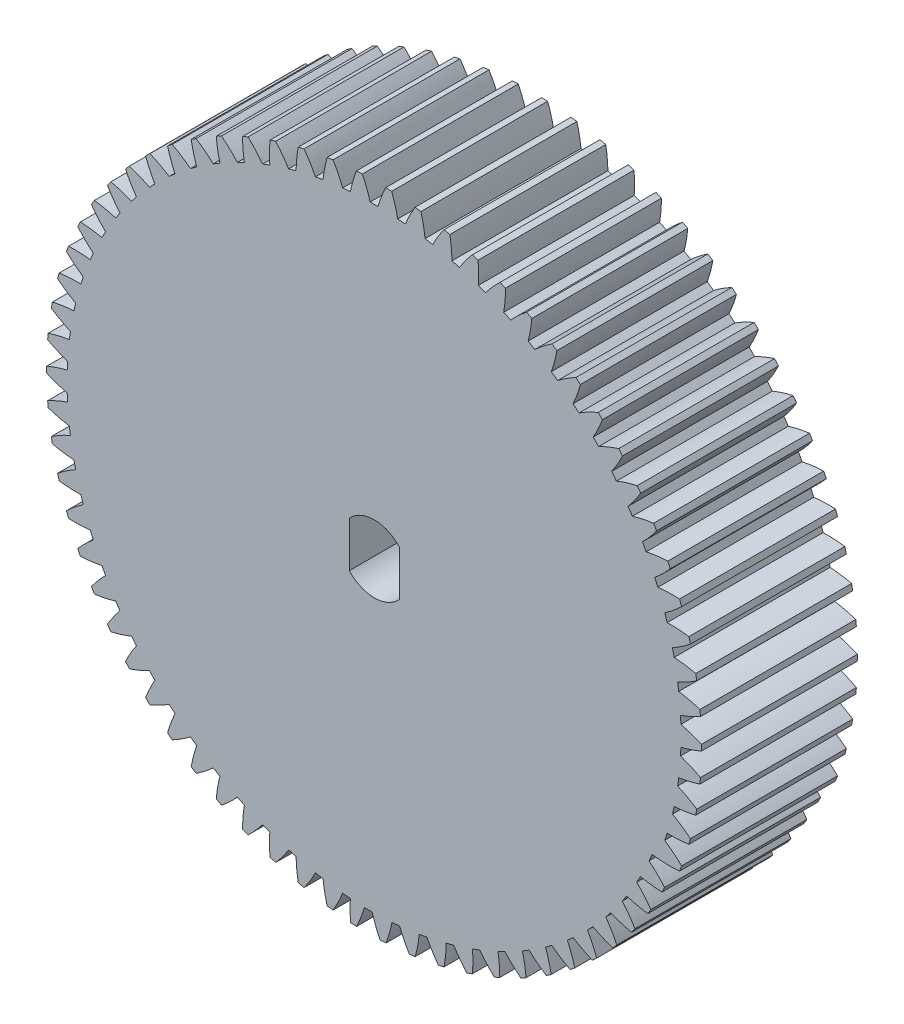
from build123d import *

# Parameters (mm, degrees)
SALIENTE_EXTRUIR1_DEPTH = 12


with BuildPart() as part:
    # Croquis1 → Saliente-Extruir1 (new body)
    with BuildSketch(Plane.XY):
        with BuildLine():
            ThreePointArc((-25.273967769, -0.161927654), (-24.491752842, -0.462970067), (-23.686675584, -0.696073767))
            ThreePointArc((-23.686675584, -0.696073767), (-23.675198138, -0.993730913), (-23.6599719, -1.291219853))
            ThreePointArc((-23.6599719, -1.291219853), (-24.44090051, -1.595548633), (-25.192969635, -1.96549124))
            ThreePointArc((-25.192969635, -1.96549124), (-25.173552209, -2.192751899), (-25.152078631, -2.419827502))
            ThreePointArc((-25.152078631, -2.419827502), (-24.346039764, -2.649537851), (-23.523320995, -2.809535754))
            ThreePointArc((-23.523320995, -2.809535754), (-23.485197172, -3.104967987), (-23.443351262, -3.399896028))
            ThreePointArc((-23.443351262, -3.399896028), (-24.193856263, -3.77300157), (-24.909736379, -4.208869854))
            ThreePointArc((-24.909736379, -4.208869854), (-24.870025633, -4.433475064), (-24.828283602, -4.65771165))
            ThreePointArc((-24.828283602, -4.65771165), (-24.004898532, -4.814244486), (-23.171149686, -4.899850343))
            ThreePointArc((-23.171149686, -4.899850343), (-23.106696997, -5.190675859), (-23.038582401, -5.480665568))
            ThreePointArc((-23.038582401, -5.480665568), (-23.752621166, -5.919543847), (-24.426548427, -6.417828452))
            ThreePointArc((-24.426548427, -6.417828452), (-24.36686409, -6.637969823), (-24.305189687, -6.857561972))
            ThreePointArc((-24.305189687, -6.857561972), (-23.471087829, -6.939656985), (-22.633021761, -6.950181547))
            ThreePointArc((-22.633021761, -6.950181547), (-22.542759141, -7.23405879), (-22.448924277, -7.516775341))
            ThreePointArc((-22.448924277, -7.516775341), (-23.120747786, -8.017892766), (-23.747296127, -8.574581797))
            ThreePointArc((-23.747296127, -8.574581797), (-23.66811874, -8.788486882), (-23.587008532, -9.001666566))
            ThreePointArc((-23.587008532, -9.001666566), (-22.748905583, -9.008662774), (-21.913269908, -8.944021305))
            ThreePointArc((-21.913269908, -8.944021305), (-21.797924099, -9.218664663), (-21.67912447, -9.491831787))
            ThreePointArc((-21.67912447, -9.491831787), (-22.303323596, -10.051153656), (-22.877448417, -10.661764982))
            ThreePointArc((-22.877448417, -10.661764982), (-22.779415471, -10.867711541), (-22.679522509, -11.072762363))
            ThreePointArc((-22.679522509, -11.072762363), (-21.844166381, -11.004603438), (-21.017689146, -10.865316391))
            ThreePointArc((-21.017689146, -10.865316391), (-20.878188845, -11.128514597), (-20.735380956, -11.389932915))
            ThreePointArc((-20.735380956, -11.389932915), (-21.306930014, -12.002955896), (-21.8240088, -12.662573232))
            ThreePointArc((-21.8240088, -12.662573232), (-21.707909599, -12.858903106), (-21.590038163, -13.054174118))
            ThreePointArc((-21.590038163, -13.054174118), (-20.764154651, -12.911408834), (-19.953490165, -12.698597668))
            ThreePointArc((-19.953490165, -12.698597668), (-19.790958546, -12.948231605), (-19.625292203, -13.195796329))
            ThreePointArc((-19.625292203, -13.195796329), (-20.139589416, -13.857584722), (-20.595458952, -14.560897218))
            ThreePointArc((-20.595458952, -14.560897218), (-20.462228258, -14.746029673), (-20.327327379, -14.929948667))
            ThreePointArc((-20.327327379, -14.929948667), (-19.517566013, -14.713726487), (-18.72924127, -14.429104632))
            ThreePointArc((-18.72924127, -14.429104632), (-18.544986942, -14.663164394), (-18.357795992, -14.894882279))
            ThreePointArc((-18.357795992, -14.894882279), (-18.810700541, -15.600107753), (-19.201690435, -16.34145275))
            ThreePointArc((-19.201690435, -16.34145275), (-19.052400943, -16.513897209), (-18.901556764, -16.684983378))
            ThreePointArc((-18.901556764, -16.684983378), (-18.114437266, -16.397045195), (-17.354799393, -16.042904259))
            ThreePointArc((-17.354799393, -16.042904259), (-17.150305863, -16.259505335), (-16.943097458, -16.473510724))
            ThreePointArc((-16.943097458, -16.473510724), (-17.330962822, -17.216495219), (-17.653925053, -17.989903842))
            ThreePointArc((-17.653925053, -17.989903842), (-17.489778754, -18.148271883), (-17.324205784, -18.305147742))
            ThreePointArc((-17.324205784, -18.305147742), (-16.566065577, -17.947811866), (-15.841230731, -17.527003183))
            ThreePointArc((-15.841230731, -17.527003183), (-15.618144462, -17.724401628), (-15.392586921, -17.918971476))
            ThreePointArc((-15.392586921, -17.918971476), (-15.712290237, -18.693732917), (-15.964624502, -19.492978136))
            ThreePointArc((-15.964624502, -19.492978136), (-15.786943007, -19.635994673), (-15.607974341, -19.777397149))
            ThreePointArc((-15.607974341, -19.777397149), (-14.884917524, -19.353540638), (-14.20072165, -18.869452313))
            ThreePointArc((-14.20072165, -18.869452313), (-13.9608388, -19.04605879), (-13.718748182, -19.219626535))
            ThreePointArc((-13.718748182, -19.219626535), (-13.967715386, -20.019926999), (-14.147390038, -20.838573761))
            ThreePointArc((-14.147390038, -20.838573761), (-13.957603933, -20.965087309), (-13.766680521, -21.089877912))
            ThreePointArc((-13.766680521, -21.089877912), (-13.084528724, -20.60291341), (-12.446480564, -20.059443036))
            ThreePointArc((-12.446480564, -20.059443036), (-12.191732529, -20.213835615), (-11.935058004, -20.365003792))
            ThreePointArc((-11.935058004, -20.365003792), (-12.111284559, -21.184399729), (-12.216852964, -22.015856771))
            ThreePointArc((-12.216852964, -22.015856771), (-12.016490294, -22.124848718), (-11.815149341, -22.232022708))
            ThreePointArc((-11.815149341, -22.232022708), (-11.179394848, -21.685870966), (-10.592631591, -21.087394248))
            ThreePointArc((-10.592631591, -21.087394248), (-10.325069453, -21.21832985), (-10.055877613, -21.345881341))
            ThreePointArc((-10.055877613, -21.345881341), (-10.157944645, -22.177775458), (-10.188556829, -23.015348377))
            ThreePointArc((-10.188556829, -23.015348377), (-9.979230798, -23.105941183), (-9.769093382, -23.194635659))
            ThreePointArc((-9.769093382, -23.194635659), (-9.184854914, -22.59369397), (-8.654100833, -21.945029491))
            ThreePointArc((-8.654100833, -21.945029491), (-8.375878844, -22.051453899), (-8.096337063, -22.154361734))
            ThreePointArc((-8.096337063, -22.154361734), (-8.123422791, -22.992056109), (-8.078832281, -23.829001261))
            ThreePointArc((-8.078832281, -23.829001261), (-7.862228258, -23.900465526), (-7.644986282, -23.969966371))
            ThreePointArc((-7.644986282, -23.969966371), (-7.116967784, -23.319073164), (-6.646496199, -22.625443588))
            ThreePointArc((-6.646496199, -22.625443588), (-6.35985444, -22.706499936), (-6.072213425, -22.783935563))
            ThreePointArc((-6.072213425, -22.783935563), (-6.024099768, -23.620685572), (-5.904665581, -24.450264366))
            ThreePointArc((-5.904665581, -24.450264366), (-5.682527536, -24.502024702), (-5.459930104, -24.551772336))
            ThreePointArc((-5.459930104, -24.551772336), (-4.992382871, -23.856168221), (-4.585981742, -23.123158246))
            ThreePointArc((-4.585981742, -23.123158246), (-4.293228083, -23.178193916), (-3.99980375, -23.229533868))
            ThreePointArc((-3.99980375, -23.229533868), (-3.876878092, -24.058602492), (-3.683561842, -24.874135648))
            ThreePointArc((-3.683561842, -24.874135648), (-3.457678299, -24.905775311), (-3.231517635, -24.935369197))
            ThreePointArc((-3.231517635, -24.935369197), (-2.828206082, -24.200654768), (-2.489147512, -23.434166159))
            ThreePointArc((-2.489147512, -23.434166159), (-2.192639034, -23.462738036), (-1.895793863, -23.487568954))
            ThreePointArc((-1.895793863, -23.487568954), (-1.918503057, -24.292813327), (-1.875, -25.097202345))
            ThreePointArc((-1.875, -25.097202345), (-1.647189639, -25.108466592), (-1.419286657, -25.117668455))
            ThreePointArc((-1.419286657, -25.117668455), (-1.083458011, -24.349759202), (-0.8144719, -23.555963275))
            ThreePointArc((-0.8144719, -23.555963275), (-0.516595915, -23.557841315), (-0.218719929, -23.555963275))
            ThreePointArc((-0.218719929, -23.555963275), (0.050266182, -24.349759202), (0.386094828, -25.117668455))
            ThreePointArc((0.386094828, -25.117668455), (0.61399781, -25.108466592), (0.841808171, -25.097202345))
            ThreePointArc((0.841808171, -25.097202345), (1.107450015, -24.302281021), (1.304197948, -23.487568954))
            ThreePointArc((1.304197948, -23.487568954), (1.601043119, -23.462738036), (1.897551597, -23.434166159))
            ThreePointArc((1.897551597, -23.434166159), (2.236610167, -24.200654768), (2.639921721, -24.935369197))
            ThreePointArc((2.639921721, -24.935369197), (2.866082384, -24.905775311), (3.091965928, -24.874135648))
            ThreePointArc((3.091965928, -24.874135648), (3.285282178, -24.058602492), (3.408207835, -23.229533868))
            ThreePointArc((3.408207835, -23.229533868), (3.701632168, -23.178193916), (3.994385827, -23.123158246))
            ThreePointArc((3.994385827, -23.123158246), (4.400786956, -23.856168221), (4.86833419, -24.551772336))
            ThreePointArc((4.86833419, -24.551772336), (5.090931621, -24.502024702), (5.313069667, -24.450264366))
            ThreePointArc((5.313069667, -24.450264366), (5.432503854, -23.620685572), (5.48061751, -22.783935563))
            ThreePointArc((5.48061751, -22.783935563), (5.768258525, -22.706499936), (6.054900284, -22.625443588))
            ThreePointArc((6.054900284, -22.625443588), (6.52537187, -23.319073164), (7.053390368, -23.969966371))
            ThreePointArc((7.053390368, -23.969966371), (7.270632344, -23.900465526), (7.487236366, -23.829001261))
            ThreePointArc((7.487236366, -23.829001261), (7.531826876, -22.992056109), (7.504741149, -22.154361734))
            ThreePointArc((7.504741149, -22.154361734), (7.78428293, -22.051453899), (8.062504918, -21.945029491))
            ThreePointArc((8.062504918, -21.945029491), (8.593258999, -22.59369397), (9.177497467, -23.194635659))
            ThreePointArc((9.177497467, -23.194635659), (9.387634883, -23.105941183), (9.596960914, -23.015348377))
            ThreePointArc((9.596960914, -23.015348377), (9.566348731, -22.177775458), (9.464281698, -21.345881341))
            ThreePointArc((9.464281698, -21.345881341), (9.733473538, -21.21832985), (10.001035677, -21.087394248))
            ThreePointArc((10.001035677, -21.087394248), (10.587798933, -21.685870966), (11.223553427, -22.232022708))
            ThreePointArc((11.223553427, -22.232022708), (11.42489438, -22.124848718), (11.625257049, -22.015856771))
            ThreePointArc((11.625257049, -22.015856771), (11.519688644, -21.184399729), (11.343462089, -20.365003792))
            ThreePointArc((11.343462089, -20.365003792), (11.600136615, -20.213835615), (11.85488465, -20.059443036))
            ThreePointArc((11.85488465, -20.059443036), (12.49293281, -20.60291341), (13.175084607, -21.089877912))
            ThreePointArc((13.175084607, -21.089877912), (13.366008018, -20.965087309), (13.555794123, -20.838573761))
            ThreePointArc((13.555794123, -20.838573761), (13.376119471, -20.019926999), (13.127152267, -19.219626535))
            ThreePointArc((13.127152267, -19.219626535), (13.369242886, -19.04605879), (13.609125736, -18.869452313))
            ThreePointArc((13.609125736, -18.869452313), (14.29332161, -19.353540638), (15.016378426, -19.777397149))
            ThreePointArc((15.016378426, -19.777397149), (15.195347092, -19.635994673), (15.373028588, -19.492978136))
            ThreePointArc((15.373028588, -19.492978136), (15.120694323, -18.693732917), (14.800991007, -17.918971476))
            ThreePointArc((14.800991007, -17.918971476), (15.026548547, -17.724401628), (15.249634817, -17.527003183))
            ThreePointArc((15.249634817, -17.527003183), (15.974469662, -17.947811866), (16.732609869, -18.305147742))
            ThreePointArc((16.732609869, -18.305147742), (16.89818284, -18.148271883), (17.062329138, -17.989903842))
            ThreePointArc((17.062329138, -17.989903842), (16.739366908, -17.216495219), (16.351501543, -16.473510724))
            ThreePointArc((16.351501543, -16.473510724), (16.558709948, -16.259505335), (16.763203478, -16.042904259))
            ThreePointArc((16.763203478, -16.042904259), (17.522841352, -16.397045195), (18.30996085, -16.684983378))
            ThreePointArc((18.30996085, -16.684983378), (18.460805029, -16.513897209), (18.61009452, -16.34145275))
            ThreePointArc((18.61009452, -16.34145275), (18.219104626, -15.600107753), (17.766200077, -14.894882279))
            ThreePointArc((17.766200077, -14.894882279), (17.953391027, -14.663164394), (18.137645356, -14.429104632))
            ThreePointArc((18.137645356, -14.429104632), (18.925970099, -14.713726487), (19.735731465, -14.929948667))
            ThreePointArc((19.735731465, -14.929948667), (19.870632344, -14.746029673), (20.003863038, -14.560897218))
            ThreePointArc((20.003863038, -14.560897218), (19.547993501, -13.857584722), (19.033696288, -13.195796329))
            ThreePointArc((19.033696288, -13.195796329), (19.199362631, -12.948231605), (19.361894251, -12.698597668))
            ThreePointArc((19.361894251, -12.698597668), (20.172558737, -12.911408834), (20.998442248, -13.054174118))
            ThreePointArc((20.998442248, -13.054174118), (21.116313684, -12.858903106), (21.232412885, -12.662573232))
            ThreePointArc((21.232412885, -12.662573232), (20.715334099, -12.002955896), (20.143785042, -11.389932915))
            ThreePointArc((20.143785042, -11.389932915), (20.28659293, -11.128514597), (20.426093231, -10.865316391))
            ThreePointArc((20.426093231, -10.865316391), (21.252570466, -11.004603438), (22.087926595, -11.072762363))
            ThreePointArc((22.087926595, -11.072762363), (22.187819557, -10.867711541), (22.285852502, -10.661764982))
            ThreePointArc((22.285852502, -10.661764982), (21.711727681, -10.051153656), (21.087528556, -9.491831787))
            ThreePointArc((21.087528556, -9.491831787), (21.206328184, -9.218664663), (21.321673993, -8.944021305))
            ThreePointArc((21.321673993, -8.944021305), (22.37778078, -9.030106977), (23.437008532, -9.001666566))
            ThreePointArc((23.437008532, -9.001666566), (23.51811874, -8.788486882), (23.597296127, -8.574581797))
            ThreePointArc((23.597296127, -8.574581797), (22.970747786, -8.017892766), (22.298924277, -7.516775341))
            ThreePointArc((22.298924277, -7.516775341), (22.392759141, -7.23405879), (22.483021761, -6.950181547))
            ThreePointArc((22.483021761, -6.950181547), (23.321087829, -6.939656985), (24.155189687, -6.857561972))
            ThreePointArc((24.155189687, -6.857561972), (24.21686409, -6.637969823), (24.276548427, -6.417828452))
            ThreePointArc((24.276548427, -6.417828452), (23.602621166, -5.919543847), (22.888582401, -5.480665568))
            ThreePointArc((22.888582401, -5.480665568), (22.956696997, -5.190675859), (23.021149686, -4.899850343))
            ThreePointArc((23.021149686, -4.899850343), (23.854898532, -4.814244486), (24.678283602, -4.65771165))
            ThreePointArc((24.678283602, -4.65771165), (24.720025633, -4.433475064), (24.759736379, -4.208869854))
            ThreePointArc((24.759736379, -4.208869854), (24.043856263, -3.77300157), (23.293351262, -3.399896028))
            ThreePointArc((23.293351262, -3.399896028), (23.335197172, -3.104967987), (23.373320995, -2.809535754))
            ThreePointArc((23.373320995, -2.809535754), (24.196039764, -2.649537851), (25.002078631, -2.419827502))
            ThreePointArc((25.002078631, -2.419827502), (25.023552209, -2.192751899), (25.042969635, -1.96549124))
            ThreePointArc((25.042969635, -1.96549124), (24.29090051, -1.595548633), (23.5099719, -1.291219853))
            ThreePointArc((23.5099719, -1.291219853), (23.525212204, -0.993728067), (23.536700211, -0.696067765))
            ThreePointArc((23.536700211, -0.696067765), (24.341764854, -0.462966025), (25.123967769, -0.161927654))
            ThreePointArc((25.123967769, -0.161927654), (25.125, 0.066158685), (25.123967769, 0.294245024))
            ThreePointArc((25.123967769, 0.294245024), (24.341764854, 0.595283395), (23.536700211, 0.828385135))
            ThreePointArc((23.536700211, 0.828385135), (23.525212204, 1.126045437), (23.5099719, 1.423537223))
            ThreePointArc((23.5099719, 1.423537223), (24.29090051, 1.727866003), (25.042969635, 2.09780861))
            ThreePointArc((25.042969635, 2.09780861), (25.023552209, 2.325069269), (25.002078631, 2.552144872))
            ThreePointArc((25.002078631, 2.552144872), (24.196039764, 2.781855222), (23.373320995, 2.941853125))
            ThreePointArc((23.373320995, 2.941853125), (23.335197172, 3.237285357), (23.293351262, 3.532213398))
            ThreePointArc((23.293351262, 3.532213398), (24.043856263, 3.90531894), (24.759736379, 4.341187224))
            ThreePointArc((24.759736379, 4.341187224), (24.720025633, 4.565792434), (24.678283602, 4.79002902))
            ThreePointArc((24.678283602, 4.79002902), (23.854898532, 4.946561857), (23.021149686, 5.032167713))
            ThreePointArc((23.021149686, 5.032167713), (22.956696997, 5.322993229), (22.888582401, 5.612982938))
            ThreePointArc((22.888582401, 5.612982938), (23.602621166, 6.051861217), (24.276548427, 6.550145822))
            ThreePointArc((24.276548427, 6.550145822), (24.21686409, 6.770287193), (24.155189687, 6.989879342))
            ThreePointArc((24.155189687, 6.989879342), (23.321087829, 7.071974355), (22.483021761, 7.082498917))
            ThreePointArc((22.483021761, 7.082498917), (22.392759141, 7.36637616), (22.298924277, 7.649092711))
            ThreePointArc((22.298924277, 7.649092711), (22.970747786, 8.150210136), (23.597296127, 8.706899168))
            ThreePointArc((23.597296127, 8.706899168), (23.51811874, 8.920804252), (23.437008532, 9.133983936))
            ThreePointArc((23.437008532, 9.133983936), (22.598905583, 9.140980145), (21.763269908, 9.076338675))
            ThreePointArc((21.763269908, 9.076338675), (21.647924099, 9.350982033), (21.52912447, 9.624149158))
            ThreePointArc((21.52912447, 9.624149158), (22.153323596, 10.183471026), (22.727448417, 10.794082352))
            ThreePointArc((22.727448417, 10.794082352), (22.629415471, 11.000028911), (22.529522509, 11.205079733))
            ThreePointArc((22.529522509, 11.205079733), (21.694166381, 11.136920808), (20.867689146, 10.997633761))
            ThreePointArc((20.867689146, 10.997633761), (20.728188845, 11.260831967), (20.585380956, 11.522250285))
            ThreePointArc((20.585380956, 11.522250285), (21.156930014, 12.135273266), (21.6740088, 12.794890602))
            ThreePointArc((21.6740088, 12.794890602), (21.557909599, 12.991220476), (21.440038163, 13.186491488))
            ThreePointArc((21.440038163, 13.186491488), (20.614154651, 13.043726204), (19.803490165, 12.830915038))
            ThreePointArc((19.803490165, 12.830915038), (19.640958546, 13.080548975), (19.475292203, 13.328113699))
            ThreePointArc((19.475292203, 13.328113699), (19.989589416, 13.989902092), (20.445458952, 14.693214588))
            ThreePointArc((20.445458952, 14.693214588), (20.312228258, 14.878347043), (20.177327379, 15.062266037))
            ThreePointArc((20.177327379, 15.062266037), (19.367566013, 14.846043857), (18.57924127, 14.561422002))
            ThreePointArc((18.57924127, 14.561422002), (18.394986942, 14.795481764), (18.207795992, 15.027199649))
            ThreePointArc((18.207795992, 15.027199649), (18.660700541, 15.732425124), (19.051690435, 16.47377012))
            ThreePointArc((19.051690435, 16.47377012), (18.902400943, 16.646214579), (18.751556764, 16.817300748))
            ThreePointArc((18.751556764, 16.817300748), (17.964437266, 16.529362566), (17.204799393, 16.175221629))
            ThreePointArc((17.204799393, 16.175221629), (17.000305863, 16.391822705), (16.793097458, 16.605828094))
            ThreePointArc((16.793097458, 16.605828094), (17.180962822, 17.348812589), (17.503925053, 18.122221212))
            ThreePointArc((17.503925053, 18.122221212), (17.339778754, 18.280589254), (17.174205784, 18.437465112))
            ThreePointArc((17.174205784, 18.437465112), (16.416065577, 18.080129236), (15.691230731, 17.659320553))
            ThreePointArc((15.691230731, 17.659320553), (15.468144462, 17.856718998), (15.242586921, 18.051288846))
            ThreePointArc((15.242586921, 18.051288846), (15.562290237, 18.826050287), (15.814624502, 19.625295506))
            ThreePointArc((15.814624502, 19.625295506), (15.636943007, 19.768312043), (15.457974341, 19.909714519))
            ThreePointArc((15.457974341, 19.909714519), (14.734917524, 19.485858008), (14.05072165, 19.001769683))
            ThreePointArc((14.05072165, 19.001769683), (13.8108388, 19.17837616), (13.568748182, 19.351943905))
            ThreePointArc((13.568748182, 19.351943905), (13.817715386, 20.152244369), (13.997390038, 20.970891131))
            ThreePointArc((13.997390038, 20.970891131), (13.807603933, 21.097404679), (13.616680521, 21.222195282))
            ThreePointArc((13.616680521, 21.222195282), (12.934528724, 20.73523078), (12.296480564, 20.191760406))
            ThreePointArc((12.296480564, 20.191760406), (12.041732529, 20.346152985), (11.785058004, 20.497321162))
            ThreePointArc((11.785058004, 20.497321162), (11.961284559, 21.316717099), (12.066852964, 22.148174141))
            ThreePointArc((12.066852964, 22.148174141), (11.866490294, 22.257166088), (11.665149341, 22.364340078))
            ThreePointArc((11.665149341, 22.364340078), (11.029394848, 21.818188336), (10.442631591, 21.219711619))
            ThreePointArc((10.442631591, 21.219711619), (10.175069453, 21.35064722), (9.905877613, 21.478198711))
            ThreePointArc((9.905877613, 21.478198711), (10.007944645, 22.310092828), (10.038556829, 23.147665748))
            ThreePointArc((10.038556829, 23.147665748), (9.829230798, 23.238258553), (9.619093382, 23.326953029))
            ThreePointArc((9.619093382, 23.326953029), (9.034854914, 22.72601134), (8.504100833, 22.077346861))
            ThreePointArc((8.504100833, 22.077346861), (8.225878844, 22.183771269), (7.946337063, 22.286679105))
            ThreePointArc((7.946337063, 22.286679105), (7.973422791, 23.124373479), (7.928832281, 23.961318631))
            ThreePointArc((7.928832281, 23.961318631), (7.712228258, 24.032782896), (7.494986282, 24.102283741))
            ThreePointArc((7.494986282, 24.102283741), (6.966967784, 23.451390534), (6.496496199, 22.757760958))
            ThreePointArc((6.496496199, 22.757760958), (6.20985444, 22.838817306), (5.922213425, 22.916252933))
            ThreePointArc((5.922213425, 22.916252933), (5.874099768, 23.753002942), (5.754665581, 24.582581736))
            ThreePointArc((5.754665581, 24.582581736), (5.532527536, 24.634342072), (5.309930104, 24.684089706))
            ThreePointArc((5.309930104, 24.684089706), (4.842382871, 23.988485591), (4.435981742, 23.255475616))
            ThreePointArc((4.435981742, 23.255475616), (4.143228083, 23.310511286), (3.84980375, 23.361851238))
            ThreePointArc((3.84980375, 23.361851238), (3.726878092, 24.190919862), (3.533561842, 25.006453018))
            ThreePointArc((3.533561842, 25.006453018), (3.307678299, 25.038092682), (3.081517635, 25.067686567))
            ThreePointArc((3.081517635, 25.067686567), (2.678206082, 24.332972138), (2.339147512, 23.566483529))
            ThreePointArc((2.339147512, 23.566483529), (2.042639034, 23.595055406), (1.745793863, 23.619886324))
            ThreePointArc((1.745793863, 23.619886324), (1.549045929, 24.434598391), (1.283404085, 25.229519715))
            ThreePointArc((1.283404085, 25.229519715), (1.055593725, 25.240783962), (0.827690742, 25.249985825))
            ThreePointArc((0.827690742, 25.249985825), (0.491862096, 24.482076572), (0.222875985, 23.688280645))
            ThreePointArc((0.222875985, 23.688280645), (-0.075, 23.690158685), (-0.372875985, 23.688280645))
            ThreePointArc((-0.372875985, 23.688280645), (-0.641862096, 24.482076572), (-0.977690742, 25.249985825))
            ThreePointArc((-0.977690742, 25.249985825), (-1.205593725, 25.240783962), (-1.433404085, 25.229519715))
            ThreePointArc((-1.433404085, 25.229519715), (-1.699045929, 24.434598391), (-1.895793863, 23.619886324))
            ThreePointArc((-1.895793863, 23.619886324), (-2.192639034, 23.595055406), (-2.489147512, 23.566483529))
            ThreePointArc((-2.489147512, 23.566483529), (-2.828206082, 24.332972138), (-3.231517635, 25.067686567))
            ThreePointArc((-3.231517635, 25.067686567), (-3.457678299, 25.038092682), (-3.683561842, 25.006453018))
            ThreePointArc((-3.683561842, 25.006453018), (-3.876878092, 24.190919862), (-3.99980375, 23.361851238))
            ThreePointArc((-3.99980375, 23.361851238), (-4.293228083, 23.310511286), (-4.585981742, 23.255475616))
            ThreePointArc((-4.585981742, 23.255475616), (-4.992382871, 23.988485591), (-5.459930104, 24.684089706))
            ThreePointArc((-5.459930104, 24.684089706), (-5.682527536, 24.634342072), (-5.904665581, 24.582581736))
            ThreePointArc((-5.904665581, 24.582581736), (-6.024099768, 23.753002942), (-6.072213425, 22.916252933))
            ThreePointArc((-6.072213425, 22.916252933), (-6.35985444, 22.838817306), (-6.646496199, 22.757760958))
            ThreePointArc((-6.646496199, 22.757760958), (-7.116967784, 23.451390534), (-7.644986282, 24.102283741))
            ThreePointArc((-7.644986282, 24.102283741), (-7.862228258, 24.032782896), (-8.078832281, 23.961318631))
            ThreePointArc((-8.078832281, 23.961318631), (-8.123422791, 23.124373479), (-8.096337063, 22.286679105))
            ThreePointArc((-8.096337063, 22.286679105), (-8.375878844, 22.183771269), (-8.654100833, 22.077346861))
            ThreePointArc((-8.654100833, 22.077346861), (-9.184854914, 22.72601134), (-9.769093382, 23.326953029))
            ThreePointArc((-9.769093382, 23.326953029), (-9.979230798, 23.238258553), (-10.188556829, 23.147665748))
            ThreePointArc((-10.188556829, 23.147665748), (-10.157944645, 22.310092828), (-10.055877613, 21.478198711))
            ThreePointArc((-10.055877613, 21.478198711), (-10.325069453, 21.35064722), (-10.592631591, 21.219711619))
            ThreePointArc((-10.592631591, 21.219711619), (-11.179394848, 21.818188336), (-11.815149341, 22.364340078))
            ThreePointArc((-11.815149341, 22.364340078), (-12.016490294, 22.257166088), (-12.216852964, 22.148174141))
            ThreePointArc((-12.216852964, 22.148174141), (-12.111284559, 21.316717099), (-11.935058004, 20.497321162))
            ThreePointArc((-11.935058004, 20.497321162), (-12.191732529, 20.346152985), (-12.446480564, 20.191760406))
            ThreePointArc((-12.446480564, 20.191760406), (-13.084528724, 20.73523078), (-13.766680521, 21.222195282))
            ThreePointArc((-13.766680521, 21.222195282), (-13.957603933, 21.097404679), (-14.147390038, 20.970891131))
            ThreePointArc((-14.147390038, 20.970891131), (-13.967715386, 20.152244369), (-13.718748182, 19.351943905))
            ThreePointArc((-13.718748182, 19.351943905), (-13.9608388, 19.17837616), (-14.20072165, 19.001769683))
            ThreePointArc((-14.20072165, 19.001769683), (-14.884917524, 19.485858008), (-15.607974341, 19.909714519))
            ThreePointArc((-15.607974341, 19.909714519), (-15.786943007, 19.768312043), (-15.964624502, 19.625295506))
            ThreePointArc((-15.964624502, 19.625295506), (-15.712290237, 18.826050287), (-15.392586921, 18.051288846))
            ThreePointArc((-15.392586921, 18.051288846), (-15.618144462, 17.856718998), (-15.841230731, 17.659320553))
            ThreePointArc((-15.841230731, 17.659320553), (-16.566065577, 18.080129236), (-17.324205784, 18.437465112))
            ThreePointArc((-17.324205784, 18.437465112), (-17.489778754, 18.280589254), (-17.653925053, 18.122221212))
            ThreePointArc((-17.653925053, 18.122221212), (-17.330962822, 17.348812589), (-16.943097458, 16.605828094))
            ThreePointArc((-16.943097458, 16.605828094), (-17.150305863, 16.391822705), (-17.354799393, 16.175221629))
            ThreePointArc((-17.354799393, 16.175221629), (-18.114437266, 16.529362566), (-18.901556764, 16.817300748))
            ThreePointArc((-18.901556764, 16.817300748), (-19.052400943, 16.646214579), (-19.201690435, 16.47377012))
            ThreePointArc((-19.201690435, 16.47377012), (-18.810700541, 15.732425124), (-18.357795992, 15.027199649))
            ThreePointArc((-18.357795992, 15.027199649), (-18.544986942, 14.795481764), (-18.72924127, 14.561422002))
            ThreePointArc((-18.72924127, 14.561422002), (-19.517566013, 14.846043857), (-20.327327379, 15.062266037))
            ThreePointArc((-20.327327379, 15.062266037), (-20.462228258, 14.878347043), (-20.595458952, 14.693214588))
            ThreePointArc((-20.595458952, 14.693214588), (-20.139589416, 13.989902092), (-19.625292203, 13.328113699))
            ThreePointArc((-19.625292203, 13.328113699), (-19.790958546, 13.080548975), (-19.953490165, 12.830915038))
            ThreePointArc((-19.953490165, 12.830915038), (-20.764154651, 13.043726204), (-21.590038163, 13.186491488))
            ThreePointArc((-21.590038163, 13.186491488), (-21.707909599, 12.991220476), (-21.8240088, 12.794890602))
            ThreePointArc((-21.8240088, 12.794890602), (-21.306930014, 12.135273266), (-20.735380956, 11.522250285))
            ThreePointArc((-20.735380956, 11.522250285), (-20.878188845, 11.260831967), (-21.017689146, 10.997633761))
            ThreePointArc((-21.017689146, 10.997633761), (-21.844166381, 11.136920808), (-22.679522509, 11.205079733))
            ThreePointArc((-22.679522509, 11.205079733), (-22.779415471, 11.000028911), (-22.877448417, 10.794082352))
            ThreePointArc((-22.877448417, 10.794082352), (-22.303323596, 10.183471026), (-21.67912447, 9.624149158))
            ThreePointArc((-21.67912447, 9.624149158), (-21.797924099, 9.350982033), (-21.913269908, 9.076338675))
            ThreePointArc((-21.913269908, 9.076338675), (-22.748905583, 9.140980145), (-23.587008532, 9.133983936))
            ThreePointArc((-23.587008532, 9.133983936), (-23.66811874, 8.920804252), (-23.747296127, 8.706899168))
            ThreePointArc((-23.747296127, 8.706899168), (-23.120747786, 8.150210136), (-22.448924277, 7.649092711))
            ThreePointArc((-22.448924277, 7.649092711), (-22.542759141, 7.36637616), (-22.633021761, 7.082498917))
            ThreePointArc((-22.633021761, 7.082498917), (-23.471087829, 7.071974355), (-24.305189687, 6.989879342))
            ThreePointArc((-24.305189687, 6.989879342), (-24.36686409, 6.770287193), (-24.426548427, 6.550145822))
            ThreePointArc((-24.426548427, 6.550145822), (-23.752621166, 6.051861217), (-23.038582401, 5.612982938))
            ThreePointArc((-23.038582401, 5.612982938), (-23.106696997, 5.322993229), (-23.171149686, 5.032167713))
            ThreePointArc((-23.171149686, 5.032167713), (-24.004898532, 4.946561857), (-24.828283602, 4.79002902))
            ThreePointArc((-24.828283602, 4.79002902), (-24.870025633, 4.565792434), (-24.909736379, 4.341187224))
            ThreePointArc((-24.909736379, 4.341187224), (-24.193856263, 3.90531894), (-23.443351262, 3.532213398))
            ThreePointArc((-23.443351262, 3.532213398), (-23.485197172, 3.237285357), (-23.523320995, 2.941853125))
            ThreePointArc((-23.523320995, 2.941853125), (-24.346039764, 2.781855222), (-25.152078631, 2.552144872))
            ThreePointArc((-25.152078631, 2.552144872), (-25.173552209, 2.325069269), (-25.192969635, 2.09780861))
            ThreePointArc((-25.192969635, 2.09780861), (-24.44090051, 1.727866003), (-23.6599719, 1.423537223))
            ThreePointArc((-23.6599719, 1.423537223), (-23.675212204, 1.126045437), (-23.686700211, 0.828385135))
            ThreePointArc((-23.686700211, 0.828385135), (-24.491764854, 0.595283395), (-25.273967769, 0.294245024))
            ThreePointArc((-25.273967769, 0.294245024), (-25.275, 0.066158685), (-25.273967769, -0.161927654))
        make_face()
        with BuildLine():
            Line((-1.978395802, 1.813835715), (-1.978395802, -1.681518345))
            ThreePointArc((-1.978395802, -1.681518345), (-0.053395802, -2.533841315), (1.871604198, -1.681518345))
            Line((1.871604198, -1.681518345), (1.871604198, 1.813835715))
            ThreePointArc((1.871604198, 1.813835715), (-0.053395802, 2.666158685), (-1.978395802, 1.813835715))
        make_face(mode=Mode.SUBTRACT)
    extrude(amount=SALIENTE_EXTRUIR1_DEPTH)


solid = part.part
